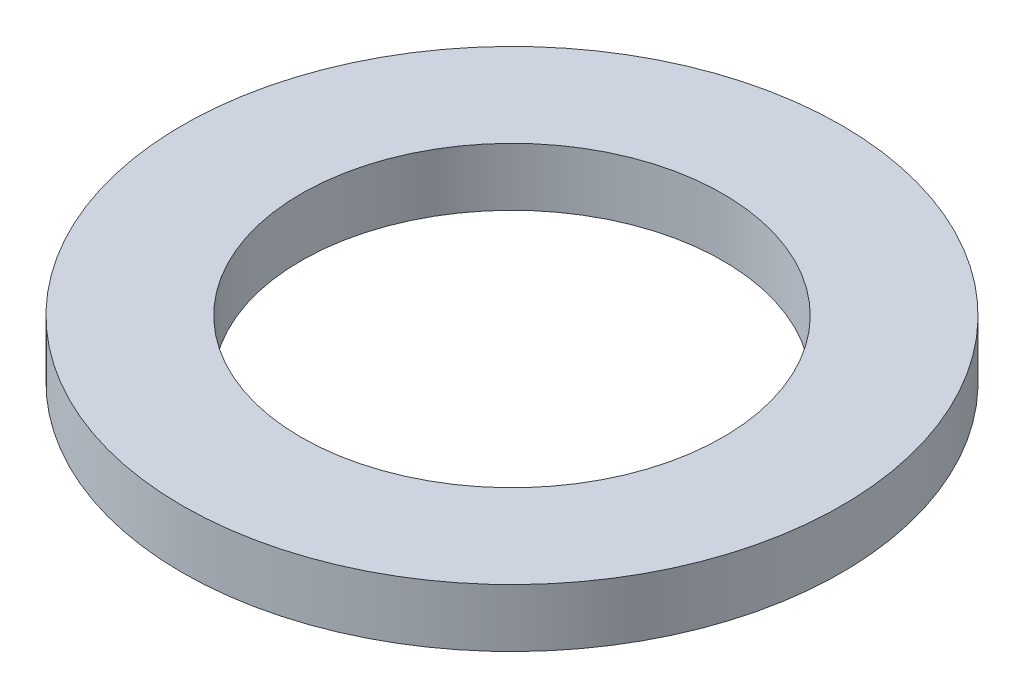
from build123d import *

# Parameters (mm, degrees)
SKETCH1_R           = 62.5
BOSS_EXTRUDE1_DEPTH = 11
SKETCH2_R           = 40
CUT_EXTRUDE1_DEPTH  = 90.070197036


with BuildPart() as part:
    # Sketch1 → Boss-Extrude1 (new body)
    with BuildSketch(Plane(origin=(0, 0, 0), x_dir=(1, 0, 0), z_dir=(0, 1, 0))):
        Circle(SKETCH1_R)
    extrude(amount=BOSS_EXTRUDE1_DEPTH)

    # Sketch2 → Cut-Extrude1 (cut, through all)
    with BuildSketch(Plane(origin=(0, 0, 0), x_dir=(1, 0, 0), z_dir=(0, 1, 0))):
        Circle(SKETCH2_R)
    extrude(amount=CUT_EXTRUDE1_DEPTH, mode=Mode.SUBTRACT)


solid = part.part
